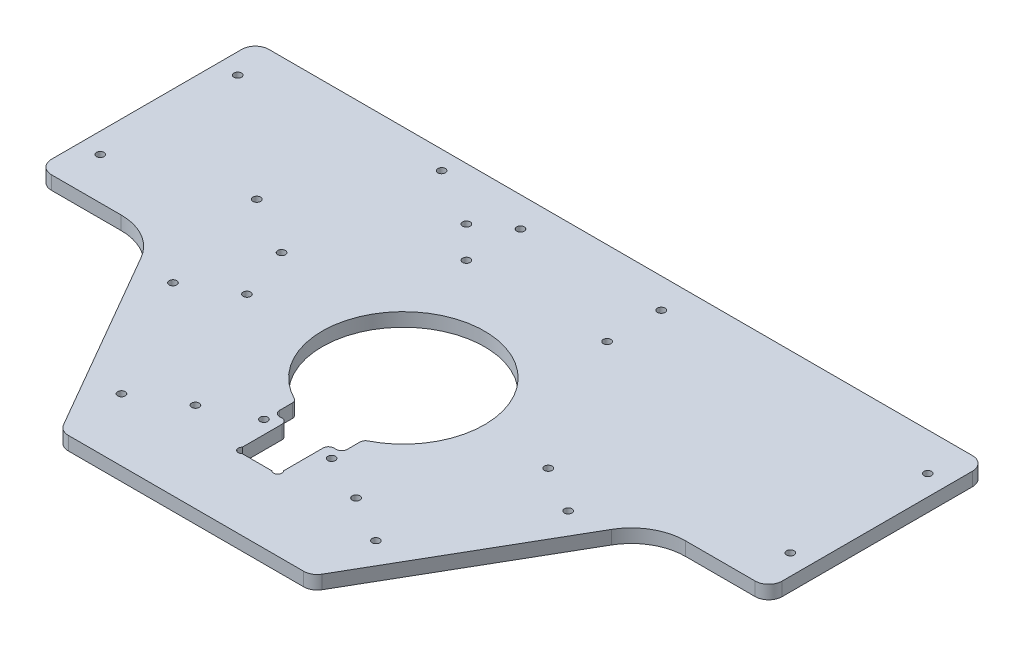
from build123d import *

# Parameters (mm, degrees)
SKETCH2_R              = 1.4
SKETCH2_R_2            = 30
BOSS_EXTRUDE1_DEPTH    = 5
SKETCH3_R              = 3.2
BOSS_EXTRUDE2_DEPTH    = 5
SKETCH5_W              = 15.2
SKETCH5_H              = 25
CUT_EXTRUDE2_DEPTH     = 152.952036544
SKETCH7_R              = 1.4
SKETCH7_R_2            = 1.5
SKETCH7_W              = 25
SKETCH7_H              = 8
CUT_EXTRUDE3_DEPTH     = 152.952036544
BOSS_EXTRUDE3_DEPTH    = 5
CUT_EXTRUDE4_OUTLINE_R = 1.4
CUT_EXTRUDE4_DEPTH     = 5
CUT_EXTRUDE5_DEPTH     = 181.884990958
FILLET1_R              = 5
FILLET2_R              = 20
FILLET3_R              = 2


# Read off the part's stored shape, not the designer's step: Cut-Extrude4
with BuildPart() as part:
    # Sketch2 → Boss-Extrude1 (new body)
    with BuildSketch(Plane(origin=(0, 0, 0), x_dir=(1, 0, 0), z_dir=(0, 1, 0))):
        Polygon((46.354723211, 80.288735773), (-46.354723211, 80.288735773), (-92.709446423, 0), (-46.354723211, -80.288735773), (46.354723211, -80.288735773), (92.709446423, 0), align=None)
        with Locations(Location((26, 69.288735773, 0), (0, 0, 270))):
            Circle(SKETCH2_R, mode=Mode.SUBTRACT)
        with Locations(Location((26, 49.288735773, 0), (0, 0, 270))):
            Circle(SKETCH2_R, mode=Mode.SUBTRACT)
        with Locations(Location((-26, 49.288735773, 0), (0, 0, 270))):
            Circle(SKETCH2_R, mode=Mode.SUBTRACT)
        with Locations(Location((-26, 69.288735773, 0), (0, 0, 270))):
            Circle(SKETCH2_R, mode=Mode.SUBTRACT)
        with Locations(Location((0, 0, 0), (0, 0, 270))):
            Circle(SKETCH2_R_2, mode=Mode.SUBTRACT)
        with Locations(Location((55.6852973, -2.127707388, 0), (0, 0, 270))):
            Circle(SKETCH2_R, mode=Mode.SUBTRACT)
        with Locations(Location((73.005805376, -12.127707388, 0), (0, 0, 270))):
            Circle(SKETCH2_R, mode=Mode.SUBTRACT)
        with Locations(Location((47.005805376, -57.161028385, 0), (0, 0, 270))):
            Circle(SKETCH2_R, mode=Mode.SUBTRACT)
        with Locations(Location((29.6852973, -47.161028385, 0), (0, 0, 270))):
            Circle(SKETCH2_R, mode=Mode.SUBTRACT)
        with Locations(Location((-29.6852973, -47.161028385, 0), (0, 0, 270))):
            Circle(SKETCH2_R, mode=Mode.SUBTRACT)
        with Locations(Location((-47.005805376, -57.161028385, 0), (0, 0, 270))):
            Circle(SKETCH2_R, mode=Mode.SUBTRACT)
        with Locations(Location((-73.005805376, -12.127707388, 0), (0, 0, 270))):
            Circle(SKETCH2_R, mode=Mode.SUBTRACT)
        with Locations(Location((-55.6852973, -2.127707388, 0), (0, 0, 270))):
            Circle(SKETCH2_R, mode=Mode.SUBTRACT)
    extrude(amount=BOSS_EXTRUDE1_DEPTH)

    # Sketch3 → Boss-Extrude2 (add)
    with BuildSketch(Plane(origin=(0, 0, 0), x_dir=(1, 0, 0), z_dir=(0, 1, 0))):
        Polygon((46.354723211, 120.288735773), (92.709446423, 120.288735773), (92.709446423, 0), (46.354723211, 80.288735773), (-46.354723211, 80.288735773), align=None)
        with Locations(Location((71.203193978, 100.288735773, 0), (0, 0, 270))):
            Circle(SKETCH3_R, mode=Mode.SUBTRACT)
    extrude(amount=BOSS_EXTRUDE2_DEPTH)

    # Sketch5 → Cut-Extrude2 (cut, through all)
    with BuildSketch(Plane(origin=(0, 5, 0), x_dir=(1, 0, 0), z_dir=(0, 1, 0))):
        with Locations((0, -41.521371436)):
            Rectangle(SKETCH5_W, SKETCH5_H)
    extrude(amount=-CUT_EXTRUDE2_DEPTH, mode=Mode.SUBTRACT)

    # Sketch7 → Cut-Extrude3 (cut, through all)
    with BuildSketch(Plane.XZ):
        with Locations(Location((-12.5, 39.021371436, 0), (0, 0, 270))):
            Circle(SKETCH7_R)
        with Locations(Location((12.5, 39.021371436, 0), (0, 0, 270))):
            Circle(SKETCH7_R)
        with Locations((-6.539339828, 52.960711264)):
            Circle(SKETCH7_R_2)
        with Locations((6.539339828, 52.960711264)):
            Circle(SKETCH7_R_2)
        with Locations((0, 31.271780287)):
            Rectangle(SKETCH7_W, SKETCH7_H)
    extrude(amount=-CUT_EXTRUDE3_DEPTH, mode=Mode.SUBTRACT)

    # Sketch8 → Boss-Extrude3 (add)
    with BuildSketch(Plane(origin=(0, 0, 0), x_dir=(1, 0, 0), z_dir=(0, 1, 0))):
        Polygon((-92.709446423, 0), (-135, 0), (-135, 80.288735773), (-46.354723211, 80.288735773), align=None)
        Polygon((92.709446423, 0), (135, 0), (135, 80.288735773), (92.709446423, 120.288735773), align=None)
    extrude(amount=BOSS_EXTRUDE3_DEPTH)

    # Cut-Extrude4 outline → Cut-Extrude4 (cut)
    with BuildSketch(Plane(origin=(0, 0, 0), x_dir=(1, 0, 0), z_dir=(0, 1, 0))):
        with Locations((-37.601356721, 60.891621456)):
            Circle(CUT_EXTRUDE4_OUTLINE_R)
        with Locations((-127.5, 66.288735773)):
            Circle(CUT_EXTRUDE4_OUTLINE_R)
        with Locations((-127.5, 15.498735773)):
            Circle(CUT_EXTRUDE4_OUTLINE_R)
        with Locations((127.5, 15.5)):
            Circle(CUT_EXTRUDE4_OUTLINE_R)
        with Locations((-59.251991815, 73.391621456)):
            Circle(CUT_EXTRUDE4_OUTLINE_R)
        with Locations((-84.251991815, 30.090351267)):
            Circle(CUT_EXTRUDE4_OUTLINE_R)
        with Locations((-62.601356721, 17.590351267)):
            Circle(CUT_EXTRUDE4_OUTLINE_R)
        with Locations((127.5, 66.29)):
            Circle(CUT_EXTRUDE4_OUTLINE_R)
    extrude(amount=CUT_EXTRUDE4_DEPTH, mode=Mode.SUBTRACT)

    # Sketch10 → Cut-Extrude5 (cut, through all)
    with BuildSketch(Plane(origin=(0, 5, 0), x_dir=(1, 0, 0), z_dir=(0, 1, 0))):
        Polygon((-46.354723211, 80.288735773), (135, 80.288735773), (92.709446423, 120.288735773), (46.354723211, 120.288735773), align=None)
    extrude(amount=-CUT_EXTRUDE5_DEPTH, mode=Mode.SUBTRACT)

    # Fillet1
    fillet1_edges = [part.edges().sort_by_distance(p)[0] for p in [
        (46.354723211, 2.5, 80.288735773),
        (-46.354723211, 2.5, 80.288735773),
        (-135, 2.5, -80.288735773),
        (-135, 2.5, 0),
        (135, 2.5, 0),
        (135, 2.5, -80.288735773),
    ]]
    fillet(fillet1_edges, radius=FILLET1_R)

    # Fillet2
    fillet2_edges = [part.edges().sort_by_distance(p)[0] for p in [
        (92.709446423, 2.5, 0),
        (-92.709446423, 2.5, 0),
    ]]
    fillet(fillet2_edges, radius=FILLET2_R)

    # Fillet3
    fillet3_edges = [part.edges().sort_by_distance(p)[0] for p in [
        (7.6, 2.5, 35.271780287),
        (-7.6, 2.5, 35.271780287),
        (-12.5, 2.5, 35.271780287),
        (12.5, 2.5, 35.271780287),
        (12.5, 2.5, 27.271780287),
        (-12.5, 2.5, 27.271780287),
    ]]
    fillet(fillet3_edges, radius=FILLET3_R)


solid = part.part
